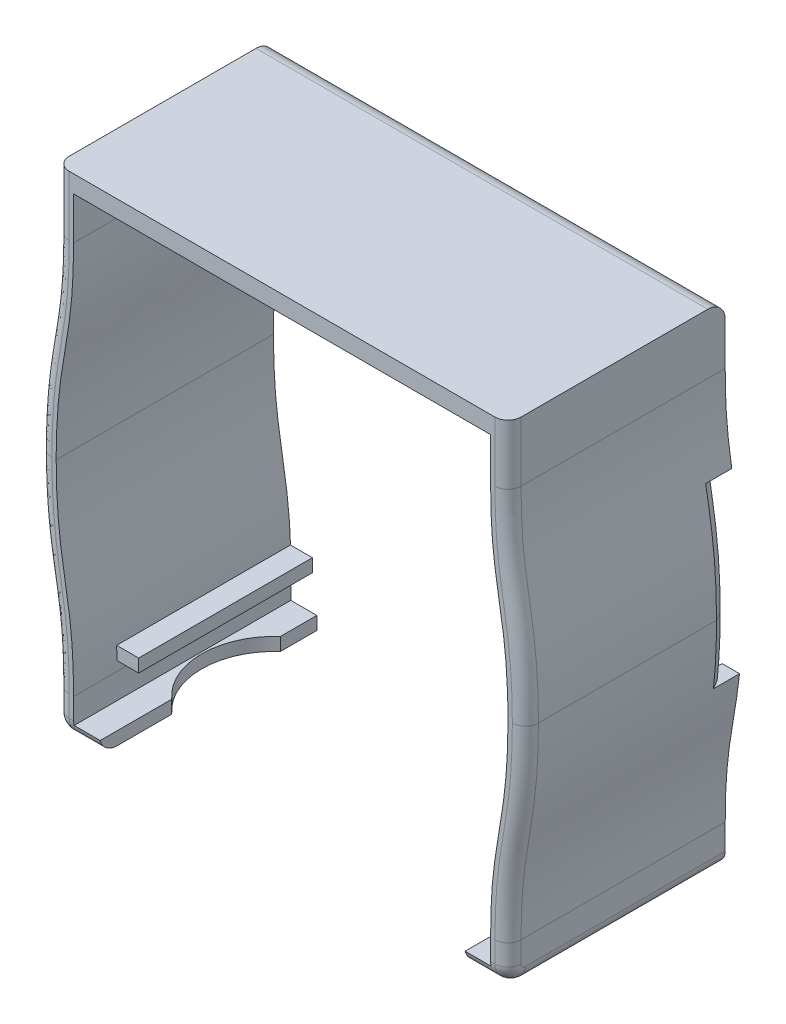
from build123d import *

# Parameters (mm, degrees)
BOSS_EXTRUDE1_DEPTH     = 25
FILLET6_R               = 2
BOSS_EXTRUDE7_START     = -5
BOSS_EXTRUDE7_DEPTH     = 20
SKETCH11_W              = 5
SKETCH11_H              = 1.5
BOSS_EXTRUDE8_DEPTH     = 25
FILLET9_R               = 2
CUT_EXTRUDE5_DEPTH      = 7
CUT_EXTRUDE5_DEPTH_BACK = 2
SKETCH12_W              = 2
SKETCH12_H              = 20
CHAMFER1_SIZE2          = 0.577350269
CHAMFER1_SIZE           = 1
CUT_EXTRUDE6_DEPTH      = 1.5
FILLET10_R              = 1.5


with BuildPart() as part:
    # Sketch1 → Boss-Extrude1 (new body)
    with BuildSketch(Plane.XY):
        with BuildLine():
            Line((26, 55.01980246), (26, 53.01980246))
            Line((26, 53.01980246), (50, 53.01980246))
            Line((50, 53.01980246), (50, 48.12495722))
            add(Edge.make_bspline(
                [(50, 48.12495722), (50, 43.400616783), (50.492700568, 39.714726917), (51.835667013, 32.063244034), (52, 27.724248993), (52, 25.51980246)],
                knots=[0, 0, 0, 0, 0.4637285, 0.673828862, 1, 1, 1, 1], degree=3))
            add(Edge.make_bspline(
                [(50, 2.9146477), (50, 7.638988137), (50.492700568, 11.324878003), (51.835667013, 18.976360887), (52, 23.315355927), (52, 25.51980246)],
                knots=[0, 0, 0, 0, 0.4637285, 0.673828862, 1, 1, 1, 1], degree=3))
            Line((50, 2.9146477), (50, 0))
            Line((50, 0), (52, 0))
            Line((52, 0), (52, 2.9146477))
            add(Edge.make_bspline(
                [(54, 25.51980246), (54, 25.07068441), (53.992531083, 24.192206821), (53.940745468, 22.277616412), (53.799828527, 19.766371626), (53.447230033, 16.66979012), (52.962423746, 13.784265603), (52.549569414, 11.292827265), (52.295765582, 9.334475594), (52.146620206, 7.635463671), (52.063812899, 6.250331281), (52.020693585, 4.959105716), (52.003017497, 3.834406668), (52, 3.216617754), (52, 2.9146477)],
                knots=[0, 0, 0, 0, 0.0625, 0.125, 0.25, 0.375, 0.5, 0.625, 0.75, 0.8125, 0.875, 0.9375, 0.96875, 1, 1, 1, 1], degree=3))
            add(Edge.make_bspline(
                [(52, 48.12495722), (52, 47.822987166), (52.003017497, 47.205198252), (52.020693585, 46.080499205), (52.063812899, 44.789273639), (52.146620206, 43.404141249), (52.295765582, 41.705129326), (52.549569414, 39.746777656), (52.962423746, 37.255339317), (53.447230033, 34.3698148), (53.799828527, 31.273233294), (53.940745468, 28.761988509), (53.992531083, 26.847398099), (54, 25.968920511), (54, 25.51980246)],
                knots=[0, 0, 0, 0, 0.03125, 0.0625, 0.125, 0.1875, 0.25, 0.375, 0.5, 0.625, 0.75, 0.875, 0.9375, 1, 1, 1, 1], degree=3))
            Line((52, 48.12495722), (52, 55.01980246))
            Line((52, 55.01980246), (26, 55.01980246))
        make_face()
    boss_extrude1 = extrude(amount=BOSS_EXTRUDE1_DEPTH)

    # Mirror4: Boss-Extrude1 across plane
    add(boss_extrude1.mirror(Plane(origin=(26, 55.01980246, 25), x_dir=(0, 0, 1), z_dir=(1, 0, 0))))

    # Fillet6
    fillet6_edges = [part.edges().sort_by_distance(p)[0] for p in [
        (26, 55.01980246, 0),
    ]]
    fillet(fillet6_edges, radius=FILLET6_R - 0.0001)  # a hair under: the kernel refuses the full size

    # Sketch10 → Boss-Extrude7 (add)
    with BuildSketch(Plane.XY.offset(25).offset(BOSS_EXTRUDE7_START)):
        with BuildLine():
            add(Edge.make_bspline(
                [(50.039218227, 5.5), (50.023722719, 5.024798812), (50.012681026, 4.526450833), (50.006340339, 4)],
                knots=[0.907636162, 0.907636162, 0.907636162, 0.907636162, 0.963181813, 0.963181813, 0.963181813, 0.963181813], degree=3))
            Line((50.039218227, 5.5), (47.506340339, 5.5))
            Line((47.506340339, 5.5), (47.506340339, 4))
            Line((47.506340339, 4), (50.006340339, 4))
        make_face()
    boss_extrude7 = extrude(amount=-BOSS_EXTRUDE7_DEPTH)

    # Sketch11 → Boss-Extrude8 (add)
    with BuildSketch(Plane.XY.offset(25)):
        with Locations((49.5, -0.75)):
            Rectangle(SKETCH11_W, SKETCH11_H)
    boss_extrude8 = extrude(amount=-BOSS_EXTRUDE8_DEPTH)

    # Mirror5: Boss-Extrude7, Boss-Extrude8 across plane
    add(boss_extrude7.mirror(Plane.ZY.offset(-26)))
    add(boss_extrude8.mirror(Plane.ZY.offset(-26)))

    # Fillet9
    fillet9_edges = [part.edges().sort_by_distance(p)[0] for p in [
        (2.5, -1.5, 25),
        (49.5, -1.5, 25),
    ]]
    fillet(fillet9_edges, radius=FILLET9_R)

    # Sketch12 → Cut-Extrude5 (cut, two sides: drawn at the far end of the back side and taken through both)
    with BuildSketch(Plane(origin=(52, 0, 0), x_dir=(0, 0, -1), z_dir=(1, 0, 0)).offset(-CUT_EXTRUDE5_DEPTH_BACK)):
        with Locations((-1, 28.51980246)):
            Rectangle(SKETCH12_W, SKETCH12_H)
    extrude(amount=CUT_EXTRUDE5_DEPTH + CUT_EXTRUDE5_DEPTH_BACK, mode=Mode.SUBTRACT)

    # Chamfer1
    chamfer1_edges = [part.edges().sort_by_distance(p)[0] for p in [
        (53.917702701, 22.01505777, 2),
        (53.698699707, 32.049983857, 2),
    ]]
    chamfer(chamfer1_edges, length=CHAMFER1_SIZE, length2=CHAMFER1_SIZE2)

    # Sketch13 → Cut-Extrude6 (cut)
    with BuildSketch(Plane.XZ.offset(1.5)):
        with BuildLine():
            Line((47, 16.7), (47, 4.2))
            ThreePointArc((47, 4.2), (49.8, 10.45), (47, 16.7))
        make_face()
    cut_extrude6 = extrude(amount=-CUT_EXTRUDE6_DEPTH, mode=Mode.SUBTRACT)

    # Mirror6: Cut-Extrude6 across plane
    add(cut_extrude6.mirror(Plane.ZY.offset(-26)), mode=Mode.SUBTRACT)

    # Fillet10
    fillet10_edges = [part.edges().sort_by_distance(p)[0] for p in [
        (0, -1.5, 11.5),
        (0, 1.70732385, 25),
        (0, -0.914213562, 24.414213562),
        (52, 1.70732385, 25),
        (52, -0.914213562, 24.414213562),
        (53.034985437, 14.212841857, 25),
        (0, 51.57237984, 25),
        (53.034985437, 36.826763064, 25),
        (-1.034985437, 36.826763064, 25),
        (-1.034985437, 14.212841857, 25),
        (52, 51.57237984, 25),
        (52, -1.5, 11.5),
    ]]
    fillet(fillet10_edges, radius=FILLET10_R)


solid = part.part
